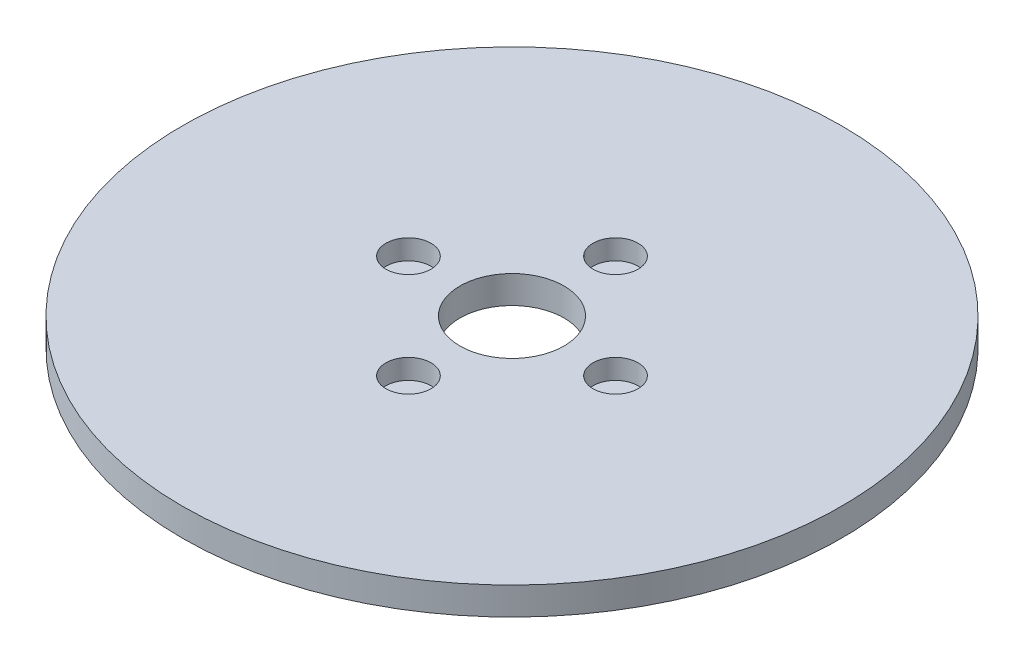
from build123d import *

# Parameters (mm, degrees)
SKETCH1_R           = 95
BOSS_EXTRUDE1_DEPTH = 8
SKETCH2_R           = 15
CUT_EXTRUDE1_DEPTH  = 135.588261004
SKETCH3_R           = 6.497474884
CUT_EXTRUDE2_DEPTH  = 5.747338522
CIRPATTERN1_COUNT   = 4


with BuildPart() as part:
    # Sketch1 → Boss-Extrude1 (new body)
    with BuildSketch(Plane(origin=(0, 0, 0), x_dir=(1, 0, 0), z_dir=(0, 1, 0))):
        Circle(SKETCH1_R)
    extrude(amount=BOSS_EXTRUDE1_DEPTH)

    # Sketch2 → Cut-Extrude1 (cut, through all)
    with BuildSketch(Plane(origin=(0, 0, 0), x_dir=(1, 0, 0), z_dir=(0, 1, 0))):
        Circle(SKETCH2_R)
    extrude(amount=CUT_EXTRUDE1_DEPTH, mode=Mode.SUBTRACT)

    # Sketch3 → Cut-Extrude2 (cut)
    with BuildSketch(Plane(origin=(0, 8, 0), x_dir=(1, 0, 0), z_dir=(0, 1, 0))):
        with Locations((-29.846033935, 0)):
            Circle(SKETCH3_R)
    cut_extrude2 = extrude(amount=-CUT_EXTRUDE2_DEPTH, mode=Mode.SUBTRACT)

    # CirPattern1: Cut-Extrude2 ×4 about axis
    cirpattern1_axis = Axis((0, 0, 0), (0, 1, 0))
    for i in range(1, CIRPATTERN1_COUNT):
        add(cut_extrude2.rotate(cirpattern1_axis, i * 360 / CIRPATTERN1_COUNT), mode=Mode.SUBTRACT)


solid = part.part
